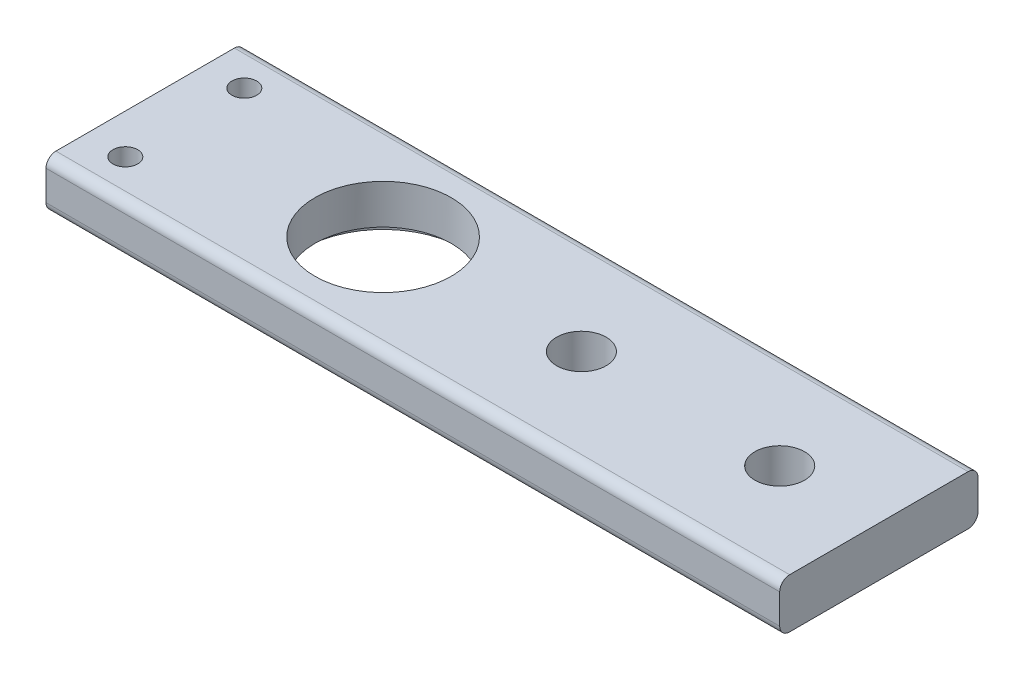
from build123d import *

# Parameters (mm, degrees)
SKETCH1_W           = 93.98
SKETCH1_H           = 25.4
BOSS_EXTRUDE1_DEPTH = 6.35
FILLET1_R           = 1.27
SKETCH2_R           = 3.175
SKETCH2_R_2         = 8.73125
SKETCH2_R_3         = 1.5875
CUT_EXTRUDE1_DEPTH  = 50.088416149
SKETCH3_R           = 10.16
CUT_EXTRUDE2_DEPTH  = 1.27


with BuildPart() as part:
    # Sketch1 → Boss-Extrude1 (new body)
    with BuildSketch(Plane(origin=(0, 0, 0), x_dir=(1, 0, 0), z_dir=(0, 1, 0))):
        Rectangle(SKETCH1_W, SKETCH1_H)
    extrude(amount=BOSS_EXTRUDE1_DEPTH)

    # Fillet1
    fillet1_edges = [part.edges().sort_by_distance(p)[0] for p in [
        (0, 0, -12.7),
        (0, 6.35, -12.7),
        (0, 0, 12.7),
        (0, 6.35, 12.7),
    ]]
    fillet(fillet1_edges, radius=FILLET1_R)

    # Sketch2 → Cut-Extrude1 (cut, through all)
    with BuildSketch(Plane(origin=(0, 6.35, 0), x_dir=(1, 0, 0), z_dir=(0, 1, 0))):
        with Locations((8.89, 0)):
            Circle(SKETCH2_R)
        with Locations((34.29, 0)):
            Circle(SKETCH2_R)
        with Locations((-16.51, 0)):
            Circle(SKETCH2_R_2)
        with Locations((-41.91, 7.62)):
            Circle(SKETCH2_R_3)
        with Locations((-41.91, -7.62)):
            Circle(SKETCH2_R_3)
    extrude(amount=-CUT_EXTRUDE1_DEPTH, mode=Mode.SUBTRACT)

    # Sketch3 → Cut-Extrude2 (cut)
    with BuildSketch(Plane(origin=(0, 0, 0), x_dir=(-1, 0, 0), z_dir=(0, -1, 0))):
        with Locations((16.51, 0)):
            Circle(SKETCH3_R)
    extrude(amount=-CUT_EXTRUDE2_DEPTH, mode=Mode.SUBTRACT)


solid = part.part
